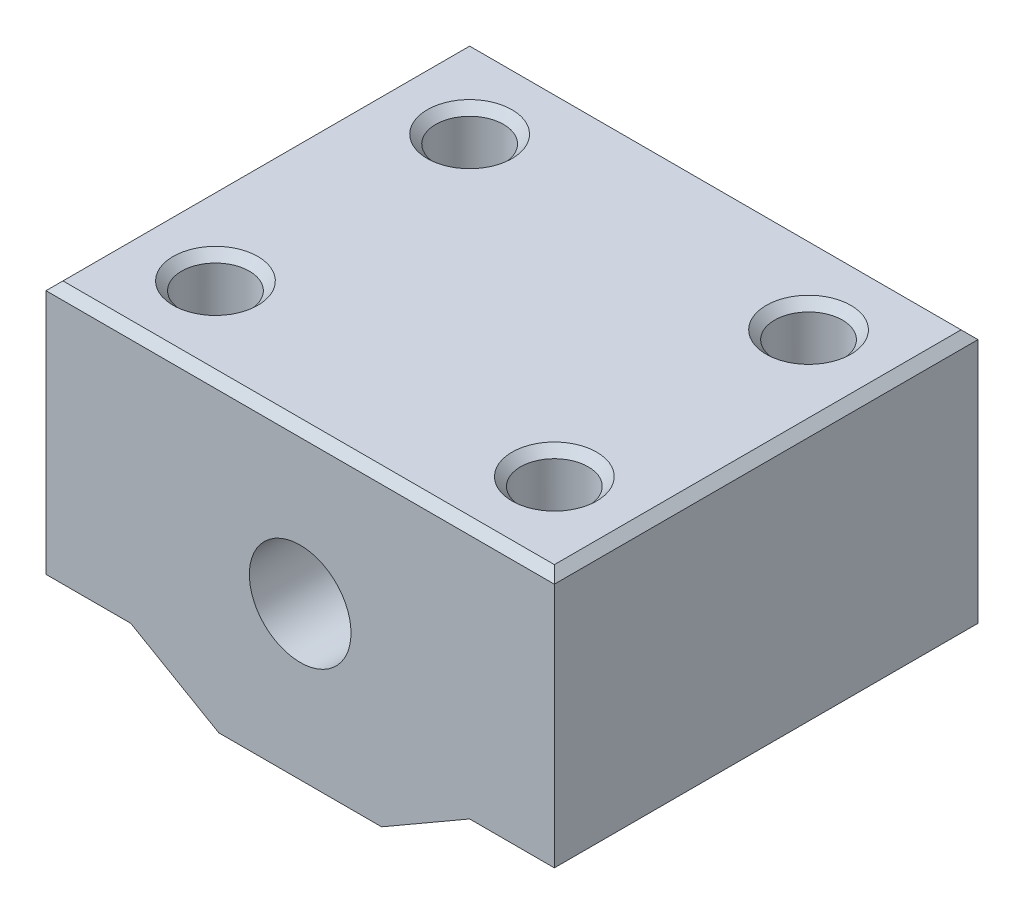
from build123d import *

# Parameters (mm, degrees)
EXTRUDE_1_DEPTH     = 25
SKETCH_2_R          = 2
CUT_EXTRUDE_1_DEPTH = 35.263683398
SKETCH_3_R          = 3
CUT_EXTRUDE_2_DEPTH = 31.987900865
CHAMFER_1_SIZE      = 0.5


with BuildPart() as part:
    # 스케치1 → 보스-돌출1 (new body)
    with BuildSketch(Plane.XY):
        Polygon((-15, -7.5), (-10, -7.5), (-4.803847577, -10.5), (4.803847577, -10.5), (10, -7.5), (15, -7.5), (15, 7.5), (-15, 7.5), align=None)
    extrude(amount=EXTRUDE_1_DEPTH)

    # 스케치2 → 컷-돌출1 (cut, through all)
    with BuildSketch(Plane(origin=(0, 7.5, 0), x_dir=(1, 0, 0), z_dir=(0, 1, 0))):
        with Locations((-10, -5)):
            Circle(SKETCH_2_R)
        with Locations((10, -5)):
            Circle(SKETCH_2_R)
        with Locations((-10, -20)):
            Circle(SKETCH_2_R)
        with Locations((10, -20)):
            Circle(SKETCH_2_R)
    extrude(amount=-CUT_EXTRUDE_1_DEPTH, mode=Mode.SUBTRACT)

    # 스케치3 → 컷-돌출2 (cut, through all)
    with BuildSketch(Plane.XY.offset(25)):
        with Locations((0, -1.5)):
            Circle(SKETCH_3_R)
    extrude(amount=-CUT_EXTRUDE_2_DEPTH, mode=Mode.SUBTRACT)

    # 모따기1
    chamfer_1_edges = [part.edges().sort_by_distance(p)[0] for p in [
        (15, 7.5, 12.5),
        (0, 7.5, 25),
        (-15, 7.5, 12.5),
        (0, 7.5, 0),
        (-12, 7.5, 5),
        (-12, 7.5, 20),
        (8, 7.5, 20),
        (8, 7.5, 5),
    ]]
    chamfer(chamfer_1_edges, length=CHAMFER_1_SIZE)


solid = part.part
